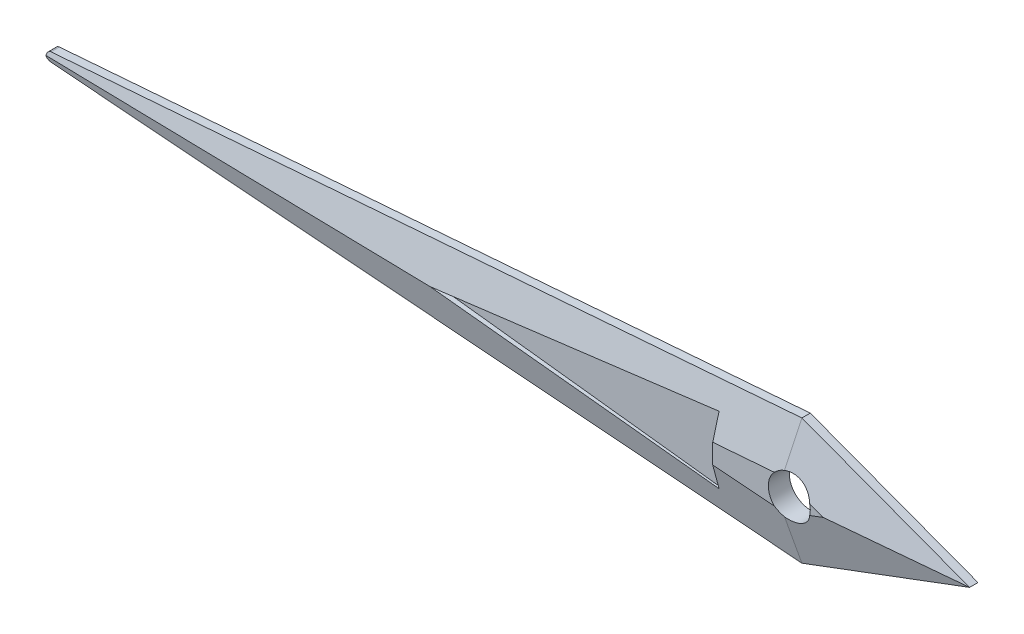
from build123d import *

# Parameters (mm, degrees)
BOSS_EXTRUDE1_DEPTH = 0.25
SKETCH2_R           = 0.25
CUT_EXTRUDE1_DEPTH  = 0.25
CHAMFER1_SIZE       = 0.15
CHAMFER1_SIZE_2     = 0.559807621
FILLET1_R           = 0.05
CUT_EXTRUDE2_DEPTH  = 0.1


with BuildPart() as part:
    # Sketch1 → Boss-Extrude1 (new body)
    with BuildSketch(Plane.XY):
        Polygon((0, 0.75), (-9, 0.05), (-9, -0.05), (0, -0.75), (2, 0), align=None)
    extrude(amount=BOSS_EXTRUDE1_DEPTH)

    # Sketch2 → Cut-Extrude1 (cut)
    with BuildSketch(Plane.XY.offset(0.25)):
        Circle(SKETCH2_R)
    extrude(amount=-CUT_EXTRUDE1_DEPTH, mode=Mode.SUBTRACT)

    # Chamfer1
    # the kernel refuses this chamfer: 0.559807621, 0.15 mm, written as the material it takes off along each edge
    with BuildSketch(Plane(origin=(3.361108509, -0.510415691, 0.25), x_dir=(0.04828384365935674, 0.12875691642495132, -0.9905000388259542), z_dir=(-0.9363291775690445, 0.3511234415883917, 0))) as chamfer1_piece_1:
        Polygon((CHAMFER1_SIZE * 0.990500038826, CHAMFER1_SIZE * 0.137512447021), (-CHAMFER1_SIZE_2 * 0.137512447055, CHAMFER1_SIZE_2 * 0.990500039065), (0, 0), align=None)
    extrude(amount=5.043329986, mode=Mode.SUBTRACT)
    with BuildSketch(Plane(origin=(1.449287487, 0.86272236, 0.25), x_dir=(-0.010663208262792517, 0.13709839195018952, -0.990500038825954), z_dir=(-0.9969889629624744, -0.07754358600819244, 0))) as chamfer1_piece_2:
        Polygon((CHAMFER1_SIZE * 0.990500038826, CHAMFER1_SIZE * 0.137512447021), (-CHAMFER1_SIZE_2 * 0.137512447055, CHAMFER1_SIZE_2 * 0.990500039065), (0, 0), align=None)
    extrude(amount=11.934510227, mode=Mode.SUBTRACT)

    # Chamfer2
    # the kernel refuses this chamfer: 0.559807621, 0.15 mm, written as the material it takes off along each edge
    with BuildSketch(Plane(origin=(-3.266660422, -1.974997658, 0.25), x_dir=(0.04828384365935697, -0.12875691642495193, -0.9905000388259542), z_dir=(0.9363291775690445, 0.3511234415883917, 0))) as chamfer2_piece_1:
        with BuildLine():
            Line((0.157289802, 0), (-0.085695312, 0.575116338))
            Line((-0.085695312, 0.575116338), (-0.096785101, 0.573576727))
            ThreePointArc((-0.096785101, 0.573576727), (-0.051067197, 0.286417039), (-0.011089789, -0.00153961))
            Line((-0.011089789, -0.00153961), (0.00153961, -0.011089789))
            ThreePointArc((0.00153961, -0.011089789), (0.078697362, -0.000377875), (0.158829412, -0.011089789))
            Line((0.158829412, -0.011089789), (0.157289802, 0))
        make_face()
    extrude(amount=8.262216566, mode=Mode.SUBTRACT)
    with BuildSketch(Plane(origin=(-9.511515098, -0.010215492, 0.25), x_dir=(-0.010663208262792486, -0.13709839195018902, -0.9905000388259542), z_dir=(0.9969889629624744, -0.0775435860081925, 0))) as chamfer2_piece_2:
        with BuildLine():
            Line((0.157289802, 0), (-0.085695312, 0.575116338))
            Line((-0.085695312, 0.575116338), (-0.096785101, 0.573576727))
            ThreePointArc((-0.096785101, 0.573576727), (-0.051067197, 0.286417039), (-0.011089789, -0.00153961))
            Line((-0.011089789, -0.00153961), (0.00153961, -0.011089789))
            ThreePointArc((0.00153961, -0.011089789), (0.078697362, -0.000377875), (0.158829412, -0.011089789))
            Line((0.158829412, -0.011089789), (0.157289802, 0))
        make_face()
    extrude(amount=13.029035977, mode=Mode.SUBTRACT)

    # Fillet1
    fillet1_edges = [part.edges().sort_by_distance(p)[0] for p in [
        (-9, 0.05, 0.05),
        (-9, -0.05, 0.05),
    ]]
    fillet(fillet1_edges, radius=FILLET1_R)

    # Sketch3 → Cut-Extrude2 (cut)
    with BuildSketch(Plane.XY.offset(0.25)):
        Polygon((-0.912980909, 0.4), (-0.912980909, -0.4), (-4.323983168, 0), align=None)
    extrude(amount=-CUT_EXTRUDE2_DEPTH, mode=Mode.SUBTRACT)


solid = part.part
